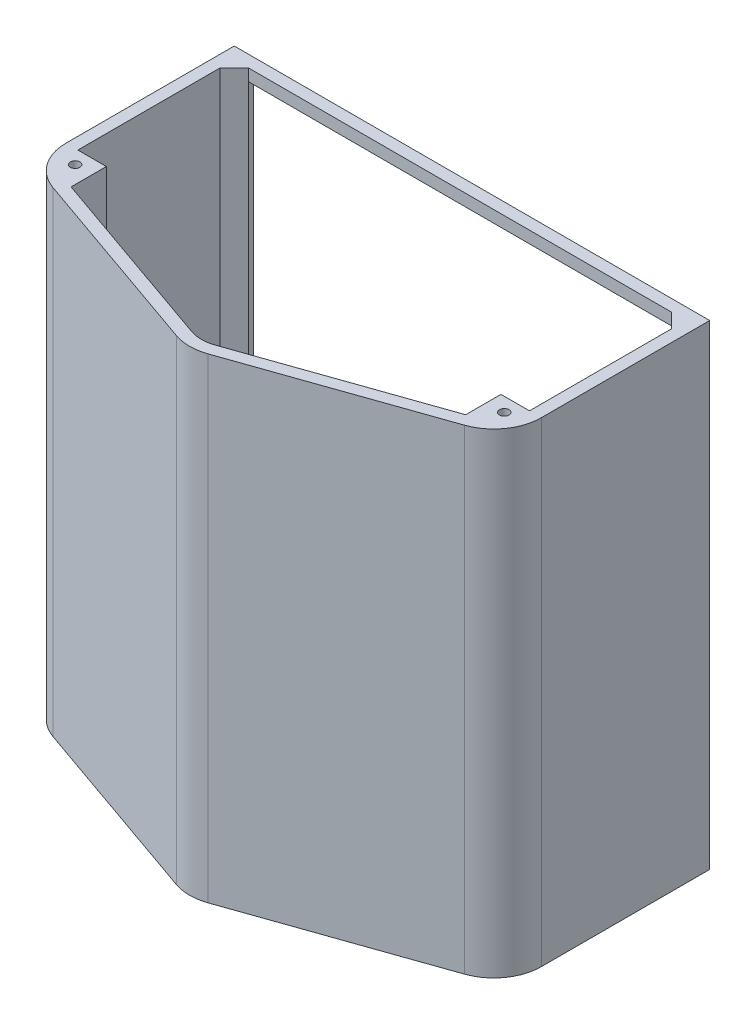
from build123d import *

# Parameters (mm, degrees)
BOSS_EXTRUDE1_DEPTH = 200
SHELL3_T            = -5
CUT_EXTRUDE1_DEPTH  = 195
BOSS_EXTRUDE2_DEPTH = 200
BOSS_EXTRUDE3_DEPTH = 200
SKETCH5_R           = 1.998576913
CUT_EXTRUDE2_DEPTH  = 210


with BuildPart() as part:
    # Sketch1 → Boss-Extrude1 (new body)
    with BuildSketch(Plane(origin=(0, 0, 0), x_dir=(1, 0, 0), z_dir=(0, 1, 0))):
        with BuildLine():
            Line((0, 0), (200, 0))
            Line((200, 0), (200, -70.8103799))
            ThreePointArc((200, -70.8103799), (196.311654881, -82.383189198), (186.607008495, -89.687547027))
            Line((186.607008495, -89.687547027), (106.607008495, -117.687547027))
            ThreePointArc((106.607008495, -117.687547027), (100, -118.8103799), (93.392991505, -117.687547027))
            Line((93.392991505, -117.687547027), (13.392991505, -89.687547027))
            ThreePointArc((13.392991505, -89.687547027), (3.688345119, -82.383189198), (0, -70.8103799))
            Line((0, -70.8103799), (0, 0))
        make_face()
    extrude(amount=BOSS_EXTRUDE1_DEPTH)

    # Shell3
    shell3_openings = [part.faces().sort_by_distance(p)[0] for p in [
        (100, 0, 51.617363214),
        (100, 200, 51.617363214),
    ]]
    offset(amount=SHELL3_T, openings=shell3_openings, kind=Kind.INTERSECTION)

    # Sketch2 → Cut-Extrude1 (cut)
    with BuildSketch(Plane(origin=(0, 0, 0), x_dir=(1, 0, 0), z_dir=(0, 1, 0))):
        Polygon((195, 0), (187.458653408, 0), (12.307944586, 0), (5, 0), (5, -3), (11, -3), (11, -5), (189, -5), (189, -3), (195, -3), align=None)
    extrude(amount=CUT_EXTRUDE1_DEPTH, mode=Mode.SUBTRACT)

    # Sketch3 → Boss-Extrude2 (add)
    with BuildSketch(Plane(origin=(0, 0, 0), x_dir=(1, 0, 0), z_dir=(0, 1, 0))):
        Polygon((5, -5), (5, -11), (11, -5), align=None)
        Polygon((195, -5), (195, -11), (189, -5), align=None)
    extrude(amount=BOSS_EXTRUDE2_DEPTH)

    # Sketch4 → Boss-Extrude3 (add)
    with BuildSketch(Plane(origin=(0, 0, 0), x_dir=(1, 0, 0), z_dir=(0, 1, 0))):
        Polygon((5, -70.8103799), (17, -70.8103799), (17, -85.652594975), (13.392991505, -89.687547027), (0, -70.8103799), align=None)
        Polygon((195, -70.8103799), (183, -70.8103799), (183, -85.652594975), (186.607008495, -89.687547027), (200, -70.8103799), align=None)
    extrude(amount=BOSS_EXTRUDE3_DEPTH)

    # Sketch5 → Cut-Extrude2 (cut)
    with BuildSketch(Plane(origin=(0, 0, 0), x_dir=(1, 0, 0), z_dir=(0, 1, 0))):
        with Locations((9.743456049, -76.677329473)):
            Circle(SKETCH5_R)
        with Locations((190.256543951, -76.677329473)):
            Circle(SKETCH5_R)
    extrude(amount=CUT_EXTRUDE2_DEPTH, mode=Mode.SUBTRACT)


solid = part.part
